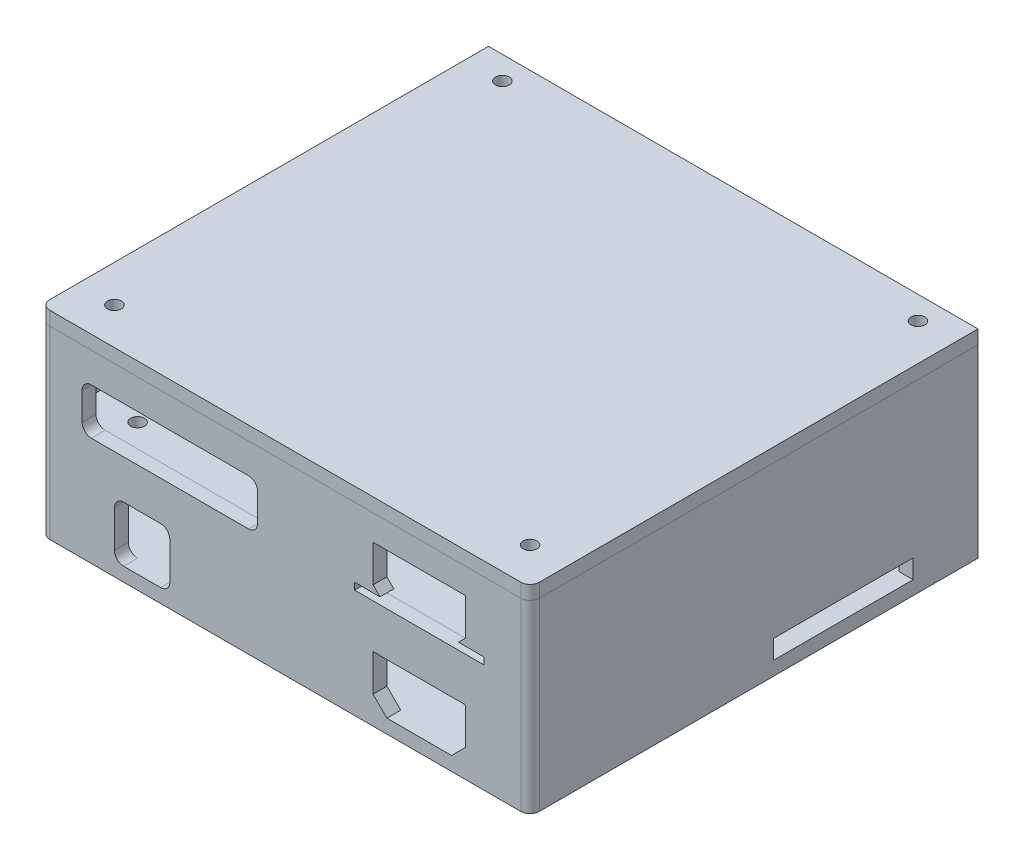
from build123d import *

# Parameters (mm, degrees)
SKETCH1_R               = 1.5
BOSS_EXTRUDE1_DEPTH     = 3
SKETCH2_W               = 97
SKETCH2_H               = 40
BOSS_EXTRUDE2_DEPTH     = 3
SKETCH3_W               = 97
SKETCH3_H               = 40
BOSS_EXTRUDE3_DEPTH     = 3
SKETCH4_W               = 106
SKETCH4_H               = 40
BOSS_EXTRUDE4_DEPTH     = 3
SKETCH5_W               = 12
SKETCH5_H               = 12
SKETCH5_W_2             = 20
SKETCH5_H_2             = 11
CUT_EXTRUDE1_DEPTH      = 3
FILLET1_R               = 2
CHAMFER1_SIZE           = 3
CUT_EXTRUDE2_DEPTH      = 85.338603261
CUT_EXTRUDE2_DEPTH_BACK = 85.338603261
SKETCH7_W               = 30.2
SKETCH7_H               = 4.1
SKETCH9_W               = 10
SKETCH9_H               = 10
SKETCH9_R               = 1.5
BOSS_EXTRUDE5_DEPTH     = 3
CHAMFER2_SIZE           = 10
SKETCH10_W              = 100
SKETCH10_H              = 94
SKETCH10_R              = 1.5
BOSS_EXTRUDE6_DEPTH     = 2.5
SKETCH11_W              = 10
SKETCH11_H              = 10
SKETCH11_R              = 1.5
BOSS_EXTRUDE7_DEPTH     = 3
SKETCH12_W              = 38
SKETCH12_H              = 10
CUT_EXTRUDE3_DEPTH      = 3
SKETCH14_R              = 1
CUT_EXTRUDE4_DEPTH      = 2.5
SKETCH15_R              = 1.5
CUT_EXTRUDE5_DEPTH      = 2.5
SKETCH16_R              = 1.25
CUT_EXTRUDE6_DEPTH      = 2.5
SKETCH17_W              = 106
SKETCH17_H              = 97
SKETCH17_R              = 1.5
BOSS_EXTRUDE8_DEPTH     = 3
FILLET2_R               = 2
FILLET3_R               = 2
FILLET4_R               = 2


with BuildPart() as part:
    # Sketch1 → Boss-Extrude1 (new body)
    with BuildSketch(Plane(origin=(0, 0, 0), x_dir=(1, 0, 0), z_dir=(0, 1, 0))):
        Polygon((-50, 45), (50, 45), (53, 45), (53, -52), (50, -52), (-50, -52), (-53, -52), (-53, 45), align=None)
        with Locations(Location((-45, 40, 0), (0, 0, 270))):
            Circle(SKETCH1_R, mode=Mode.SUBTRACT)
        with Locations(Location((45, 40, 0), (0, 0, 270))):
            Circle(SKETCH1_R, mode=Mode.SUBTRACT)
        with Locations(Location((-45, 25.84, 0), (0, 0, 270))):
            Circle(SKETCH1_R, mode=Mode.SUBTRACT)
        with Locations(Location((-45, 5.84, 0), (0, 0, 270))):
            Circle(SKETCH1_R, mode=Mode.SUBTRACT)
        with Locations(Location((45, 5.84, 0), (0, 0, 90))):
            Circle(SKETCH1_R, mode=Mode.SUBTRACT)
        with Locations(Location((45, 25.84, 0), (0, 0, 90))):
            Circle(SKETCH1_R, mode=Mode.SUBTRACT)
        with Locations(Location((-34, 31.5, 0), (0, 0, 270))):
            Circle(SKETCH1_R, mode=Mode.SUBTRACT)
        with Locations(Location((21.5, 31.5, 0), (0, 0, 270))):
            Circle(SKETCH1_R, mode=Mode.SUBTRACT)
        with Locations(Location((-21, -36.5, 0), (0, 0, 270))):
            Circle(SKETCH1_R, mode=Mode.SUBTRACT)
        with Locations(Location((32.5, -25.5, 0), (0, 0, 270))):
            Circle(SKETCH1_R, mode=Mode.SUBTRACT)
    extrude(amount=BOSS_EXTRUDE1_DEPTH)

    # Sketch2 → Boss-Extrude2 (add)
    with BuildSketch(Plane.ZY.offset(53)):
        with Locations((3.5, 20)):
            Rectangle(SKETCH2_W, SKETCH2_H)
    extrude(amount=-BOSS_EXTRUDE2_DEPTH)

    # Sketch3 → Boss-Extrude3 (add)
    with BuildSketch(Plane(origin=(53, 0, 0), x_dir=(0, 0, -1), z_dir=(1, 0, 0))):
        with Locations((-3.5, 20)):
            Rectangle(SKETCH3_W, SKETCH3_H)
    extrude(amount=-BOSS_EXTRUDE3_DEPTH)

    # Sketch4 → Boss-Extrude4 (add)
    with BuildSketch(Plane.XY.offset(52)):
        with Locations((0, 20)):
            Rectangle(SKETCH4_W, SKETCH4_H)
    extrude(amount=-BOSS_EXTRUDE4_DEPTH)

    # Sketch5 → Cut-Extrude1 (cut)
    with BuildSketch(Plane(origin=(0, 0, 49), x_dir=(-1, 0, 0), z_dir=(0, 0, -1))):
        with Locations((31, 9)):
            Rectangle(SKETCH5_W, SKETCH5_H)
        with Locations((-29, 8.5)):
            Rectangle(SKETCH5_W_2, SKETCH5_H_2)
    extrude(amount=-CUT_EXTRUDE1_DEPTH, mode=Mode.SUBTRACT)

    # Fillet1
    fillet1_edges = [part.edges().sort_by_distance(p)[0] for p in [
        (-37, 3, 50.5),
        (-25, 3, 50.5),
        (-25, 15, 50.5),
        (-37, 15, 50.5),
    ]]
    fillet(fillet1_edges, radius=FILLET1_R)

    # Chamfer1
    chamfer1_edges = [part.edges().sort_by_distance(p)[0] for p in [
        (19, 3, 50.5),
        (39, 3, 50.5),
    ]]
    chamfer(chamfer1_edges, length=CHAMFER1_SIZE)

    # Sketch7 → Cut-Extrude2 (cut, two sides: drawn at the far end of the back side and taken through both)
    with BuildSketch(Plane(origin=(0, 0, 0), x_dir=(0, 0, -1), z_dir=(1, 0, 0)).offset(-CUT_EXTRUDE2_DEPTH_BACK)):
        with Locations((15.84, 5.05)):
            Rectangle(SKETCH7_W, SKETCH7_H)
    extrude(amount=CUT_EXTRUDE2_DEPTH + CUT_EXTRUDE2_DEPTH_BACK, mode=Mode.SUBTRACT)

    # Sketch9 → Boss-Extrude5 (add)
    # profile 1 of 4: a face of its own
    with BuildSketch(Plane(origin=(0, 18, 0), x_dir=(1, 0, 0), z_dir=(0, 1, 0))):
        with Locations((-45, 15.84)):
            Rectangle(SKETCH9_W, SKETCH9_H)
        with Locations(Location((-45, 15.84, 0), (0, 0, 270))):
            Circle(SKETCH9_R, mode=Mode.SUBTRACT)
    # profile 2 of 4: a face of its own
    with BuildSketch(Plane(origin=(0, 18, 0), x_dir=(1, 0, 0), z_dir=(0, 1, 0))):
        with Locations((45, 15.84)):
            Rectangle(SKETCH9_W, SKETCH9_H)
        with Locations(Location((45, 15.84, 0), (0, 0, 90))):
            Circle(SKETCH9_R, mode=Mode.SUBTRACT)
    # profile 3 of 4: a face of its own
    with BuildSketch(Plane(origin=(0, 18, 0), x_dir=(1, 0, 0), z_dir=(0, 1, 0))):
        with Locations((45, -19.84)):
            Rectangle(SKETCH9_W, SKETCH9_H)
        with Locations(Location((45, -19.84, 0), (0, 0, 270))):
            Circle(SKETCH9_R, mode=Mode.SUBTRACT)
    # profile 4 of 4: a face of its own
    with BuildSketch(Plane(origin=(0, 18, 0), x_dir=(1, 0, 0), z_dir=(0, 1, 0))):
        with Locations((-45, -19.84)):
            Rectangle(SKETCH9_W, SKETCH9_H)
        with Locations(Location((-45, -19.84, 0), (0, 0, 90))):
            Circle(SKETCH9_R, mode=Mode.SUBTRACT)
    extrude(amount=BOSS_EXTRUDE5_DEPTH)

    # Chamfer2
    chamfer2_edges = [part.edges().sort_by_distance(p)[0] for p in [
        (50, 19.5, 14.84),
        (50, 19.5, -10.84),
        (-50, 19.5, 14.84),
        (-50, 19.5, -10.84),
        (50, 19.5, -20.84),
        (50, 19.5, 24.84),
        (-50, 19.5, -20.84),
        (-50, 19.5, 24.84),
    ]]
    chamfer(chamfer2_edges, length=CHAMFER2_SIZE - 0.0001)  # a hair under: the kernel refuses the full size

    # Sketch11 → Boss-Extrude7 (add)
    # profile 1 of 2: a face of its own
    with BuildSketch(Plane(origin=(0, 40, 0), x_dir=(1, 0, 0), z_dir=(0, 1, 0))):
        with Locations((-45, -44)):
            Rectangle(SKETCH11_W, SKETCH11_H)
        with Locations(Location((-45, -44, 0), (0, 0, 270))):
            Circle(SKETCH11_R, mode=Mode.SUBTRACT)
    # profile 2 of 2: a face of its own
    with BuildSketch(Plane(origin=(0, 40, 0), x_dir=(1, 0, 0), z_dir=(0, 1, 0))):
        with Locations((45, -44)):
            Rectangle(SKETCH11_W, SKETCH11_H)
        with Locations(Location((45, -44, 0), (0, 0, 90))):
            Circle(SKETCH11_R, mode=Mode.SUBTRACT)
    extrude(amount=-BOSS_EXTRUDE7_DEPTH)

    # Sketch12 → Cut-Extrude3 (cut)
    with BuildSketch(Plane(origin=(0, 0, 49), x_dir=(-1, 0, 0), z_dir=(0, 0, -1))):
        Polygon((-36, 23.5), (-22, 23.5), (-15, 23.5), (-15, 25), (-20.5, 25), (-19, 26.5), (-19, 34.5), (-39, 34.5), (-39, 26.5), (-37.5, 25), (-43, 25), (-43, 23.5), align=None)
        with Locations((25, 28.5)):
            Rectangle(SKETCH12_W, SKETCH12_H)
    extrude(amount=-CUT_EXTRUDE3_DEPTH, mode=Mode.SUBTRACT)

    # Fillet2
    fillet2_edges = [part.edges().sort_by_distance(p)[0] for p in [
        (-44, 23.5, 50.5),
        (-6, 23.5, 50.5),
        (-6, 33.5, 50.5),
        (-44, 33.5, 50.5),
    ]]
    fillet(fillet2_edges, radius=FILLET2_R)

    # Fillet3
    fillet3_edges = [part.edges().sort_by_distance(p)[0] for p in [
        (53, 20, 52),
        (-53, 20, 52),
    ]]
    fillet(fillet3_edges, radius=FILLET3_R)


with BuildPart() as body_2:
    # Sketch10 → Boss-Extrude6 (new body)
    with BuildSketch(Plane(origin=(0, 21, 0), x_dir=(1, 0, 0), z_dir=(0, 1, 0))):
        with Locations((0, -2)):
            Rectangle(SKETCH10_W, SKETCH10_H)
        with Locations(Location((-45, 15.84, 0), (0, 0, 270))):
            Circle(SKETCH10_R, mode=Mode.SUBTRACT)
        with Locations(Location((-45, -19.84, 0), (0, 0, 270))):
            Circle(SKETCH10_R, mode=Mode.SUBTRACT)
        with Locations(Location((45, -19.84, 0), (0, 0, 270))):
            Circle(SKETCH10_R, mode=Mode.SUBTRACT)
        with Locations(Location((45, 15.84, 0), (0, 0, 270))):
            Circle(SKETCH10_R, mode=Mode.SUBTRACT)
    extrude(amount=BOSS_EXTRUDE6_DEPTH)

    # Sketch14 → Cut-Extrude4 (cut)
    with BuildSketch(Plane(origin=(0, 23.5, 0), x_dir=(1, 0, 0), z_dir=(0, 1, 0))):
        with Locations(Location((18.5, -39, 0), (0, 0, 270))):
            Circle(SKETCH14_R)
        with Locations(Location((39.5, -39, 0), (0, 0, 270))):
            Circle(SKETCH14_R)
    extrude(amount=-CUT_EXTRUDE4_DEPTH, mode=Mode.SUBTRACT)

    # Sketch15 → Cut-Extrude5 (cut)
    with BuildSketch(Plane(origin=(0, 23.5, 0), x_dir=(1, 0, 0), z_dir=(0, 1, 0))):
        with Locations(Location((-40, -44, 0), (0, 0, 270))):
            Circle(SKETCH15_R)
        with Locations(Location((-10, -44, 0), (0, 0, 270))):
            Circle(SKETCH15_R)
    extrude(amount=-CUT_EXTRUDE5_DEPTH, mode=Mode.SUBTRACT)

    # Sketch16 → Cut-Extrude6 (cut)
    with BuildSketch(Plane(origin=(0, 23.5, 0), x_dir=(1, 0, 0), z_dir=(0, 1, 0))):
        with Locations(Location((0, 0, 0), (0, 0, 270))):
            Circle(SKETCH16_R)
        with Locations(Location((0, 16, 0), (0, 0, 270))):
            Circle(SKETCH16_R)
    extrude(amount=-CUT_EXTRUDE6_DEPTH, mode=Mode.SUBTRACT)


with BuildPart() as body_3:
    # Sketch17 → Boss-Extrude8 (new body)
    with BuildSketch(Plane(origin=(0, 40, 0), x_dir=(1, 0, 0), z_dir=(0, 1, 0))):
        with Locations((0, -3.5)):
            Rectangle(SKETCH17_W, SKETCH17_H)
        with Locations(Location((-45, -44, 0), (0, 0, 270))):
            Circle(SKETCH17_R, mode=Mode.SUBTRACT)
        with Locations(Location((45, 40, 0), (0, 0, 270))):
            Circle(SKETCH17_R, mode=Mode.SUBTRACT)
        with Locations(Location((-45, 40, 0), (0, 0, 270))):
            Circle(SKETCH17_R, mode=Mode.SUBTRACT)
        with Locations(Location((45, -44, 0), (0, 0, 270))):
            Circle(SKETCH17_R, mode=Mode.SUBTRACT)
    extrude(amount=BOSS_EXTRUDE8_DEPTH)

    # Fillet4
    fillet4_edges = [body_3.edges().sort_by_distance(p)[0] for p in [
        (53, 41.5, 52),
        (-53, 41.5, 52),
    ]]
    fillet(fillet4_edges, radius=FILLET4_R)


solid = Compound([part.part, body_2.part, body_3.part])
